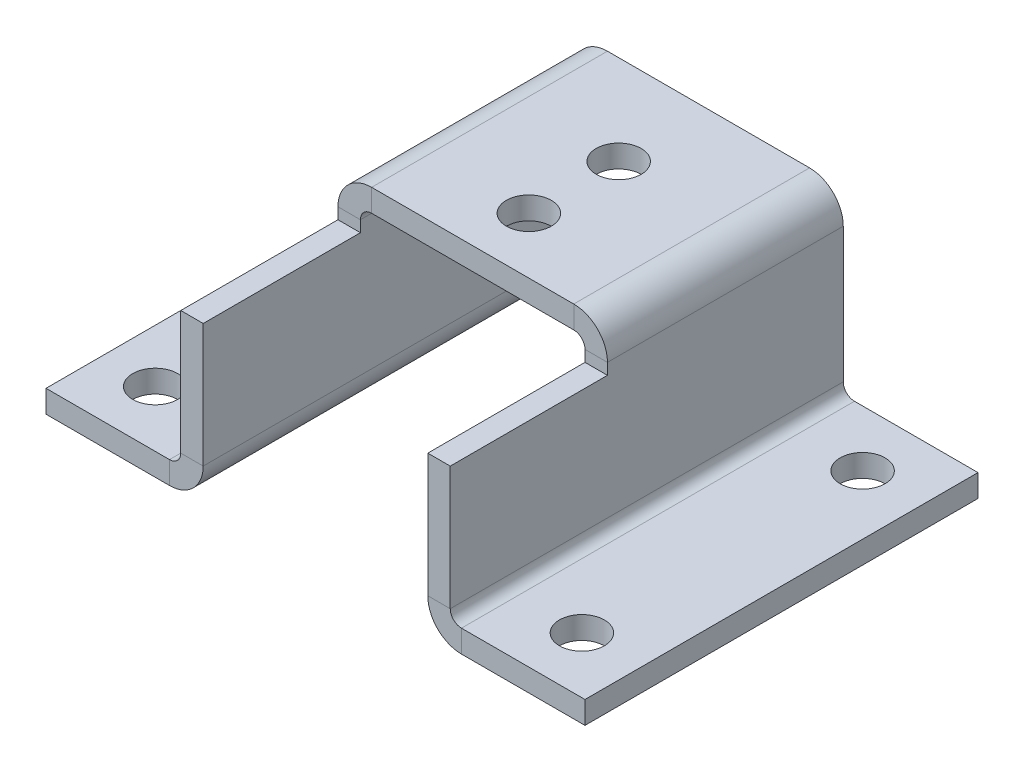
from build123d import *

# Parameters (mm, degrees)
BASE_FLANGE2_DEPTH = 35
SKETCH12_W         = 24
SKETCH12_H         = 14
CUT_EXTRUDE1_DEPTH = 4
CUT_EXTRUDE2_REACH = 48.098
SKETCH13_R         = 2


# Sheet-metal steps are written as plain solids
with BuildPart() as part:
    # Sketch7 → Base-Flange2 (new body)
    with BuildSketch(Plane.XY):
        with BuildLine():
            Line((-24, -16), (-13, -16))
            ThreePointArc((-13, -16), (-12.292893219, -15.707106781), (-12, -15))
            Line((-12, -15), (-12, -3))
            ThreePointArc((-12, -3), (-11.121320344, -0.878679656), (-9, 0))
            Line((-9, 0), (9, 0))
            ThreePointArc((9, 0), (11.121320344, -0.878679656), (12, -3))
            Line((12, -3), (12, -15))
            ThreePointArc((12, -15), (12.292893219, -15.707106781), (13, -16))
            Line((13, -16), (24, -16))
            Line((24, -16), (24, -18))
            Line((24, -18), (13, -18))
            ThreePointArc((13, -18), (10.878679656, -17.121320344), (10, -15))
            Line((10, -15), (10, -3))
            ThreePointArc((10, -3), (9.707106781, -2.292893219), (9, -2))
            Line((9, -2), (-9, -2))
            ThreePointArc((-9, -2), (-9.707106781, -2.292893219), (-10, -3))
            Line((-10, -3), (-10, -15))
            ThreePointArc((-10, -15), (-10.878679656, -17.121320344), (-13, -18))
            Line((-13, -18), (-24, -18))
            Line((-24, -18), (-24, -16))
        make_face()
    extrude(amount=BASE_FLANGE2_DEPTH)

    # Sketch12 → Cut-Extrude1 (cut)
    with BuildSketch(Plane(origin=(0, 0, 0), x_dir=(1, 0, 0), z_dir=(0, 1, 0))):
        with Locations((0, -28)):
            Rectangle(SKETCH12_W, SKETCH12_H)
    extrude(amount=-CUT_EXTRUDE1_DEPTH, mode=Mode.SUBTRACT)

    # Sketch13 → Cut-Extrude2 (cut, up to next)
    with BuildSketch(Plane(origin=(0, 0, 0), x_dir=(1, 0, 0), z_dir=(0, 1, 0)), mode=Mode.PRIVATE) as cut_extrude2_sk1:
        with Locations(Location((18.725249298, -5, 0), (0, 0, 270))):
            Circle(SKETCH13_R)
    cut_extrude2_tool1 = extrude(cut_extrude2_sk1.sketch, amount=-CUT_EXTRUDE2_REACH, mode=Mode.PRIVATE) & part.part
    # Sketch13 → Cut-Extrude2 (cut, up to next)
    with BuildSketch(Plane(origin=(0, 0, 0), x_dir=(1, 0, 0), z_dir=(0, 1, 0)), mode=Mode.PRIVATE) as cut_extrude2_sk2:
        with Locations(Location((-19.274750702, -5, 0), (0, 0, 270))):
            Circle(SKETCH13_R)
    cut_extrude2_tool2 = extrude(cut_extrude2_sk2.sketch, amount=-CUT_EXTRUDE2_REACH, mode=Mode.PRIVATE) & part.part
    # Sketch13 → Cut-Extrude2 (cut, up to next)
    with BuildSketch(Plane(origin=(0, 0, 0), x_dir=(1, 0, 0), z_dir=(0, 1, 0)), mode=Mode.PRIVATE) as cut_extrude2_sk3:
        with Locations(Location((0, -8, 0), (0, 0, 270))):
            Circle(SKETCH13_R)
    cut_extrude2_tool3 = extrude(cut_extrude2_sk3.sketch, amount=-CUT_EXTRUDE2_REACH, mode=Mode.PRIVATE) & part.part
    # Sketch13 → Cut-Extrude2 (cut, up to next)
    with BuildSketch(Plane(origin=(0, 0, 0), x_dir=(1, 0, 0), z_dir=(0, 1, 0)), mode=Mode.PRIVATE) as cut_extrude2_sk4:
        with Locations(Location((0, -16, 0), (0, 0, 270))):
            Circle(SKETCH13_R)
    cut_extrude2_tool4 = extrude(cut_extrude2_sk4.sketch, amount=-CUT_EXTRUDE2_REACH, mode=Mode.PRIVATE) & part.part
    # Sketch13 → Cut-Extrude2 (cut, up to next)
    with BuildSketch(Plane(origin=(0, 0, 0), x_dir=(1, 0, 0), z_dir=(0, 1, 0)), mode=Mode.PRIVATE) as cut_extrude2_sk5:
        with Locations(Location((18.725249298, -30, 0), (0, 0, 270))):
            Circle(SKETCH13_R)
    cut_extrude2_tool5 = extrude(cut_extrude2_sk5.sketch, amount=-CUT_EXTRUDE2_REACH, mode=Mode.PRIVATE) & part.part
    # Sketch13 → Cut-Extrude2 (cut, up to next)
    with BuildSketch(Plane(origin=(0, 0, 0), x_dir=(1, 0, 0), z_dir=(0, 1, 0)), mode=Mode.PRIVATE) as cut_extrude2_sk6:
        with Locations(Location((-19.274750702, -30, 0), (0, 0, 270))):
            Circle(SKETCH13_R)
    cut_extrude2_tool6 = extrude(cut_extrude2_sk6.sketch, amount=-CUT_EXTRUDE2_REACH, mode=Mode.PRIVATE) & part.part
    add(cut_extrude2_tool1.solids().sort_by_distance((18.725249, 0, 5))[0], mode=Mode.SUBTRACT)
    add(cut_extrude2_tool2.solids().sort_by_distance((-19.274751, 0, 5))[0], mode=Mode.SUBTRACT)
    add(cut_extrude2_tool3.solids().sort_by_distance((0, 0, 8))[0], mode=Mode.SUBTRACT)
    add(cut_extrude2_tool4.solids().sort_by_distance((0, 0, 16))[0], mode=Mode.SUBTRACT)
    add(cut_extrude2_tool5.solids().sort_by_distance((18.725249, 0, 30))[0], mode=Mode.SUBTRACT)
    add(cut_extrude2_tool6.solids().sort_by_distance((-19.274751, 0, 30))[0], mode=Mode.SUBTRACT)


solid = part.part
